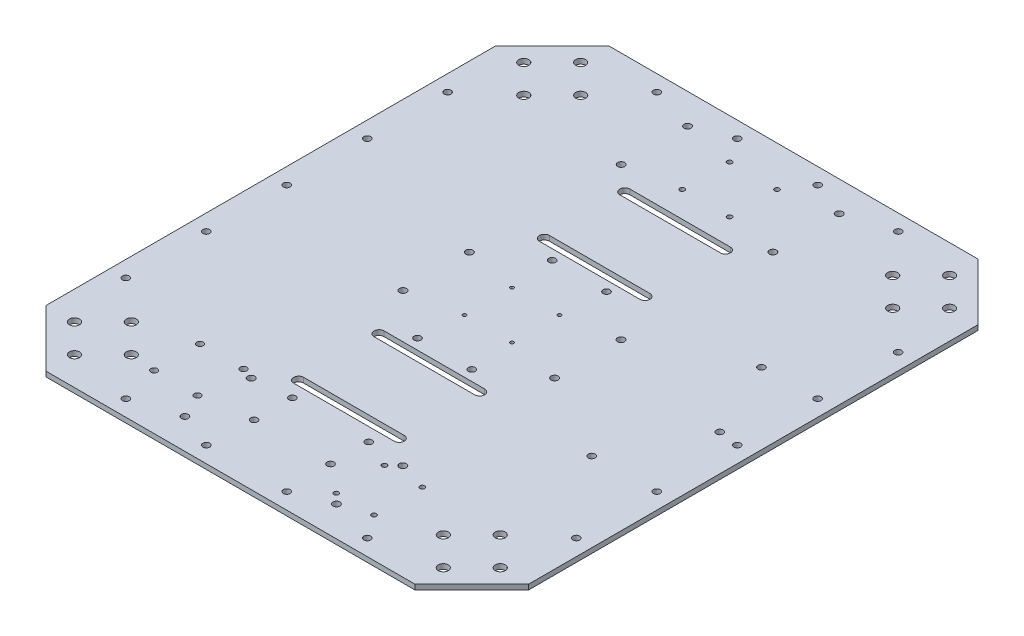
from build123d import *

# Parameters (mm, degrees)
SKETCH1_R               = 2.2225
BOSS_EXTRUDE1_DEPTH     = 3.175
SKETCH2_R               = 2.159
CUT_EXTRUDE1_DEPTH      = 297.247830215
CUT_EXTRUDE2_DEPTH      = 297.247830215
SKETCH7_R               = 1.524
CUT_EXTRUDE3_DEPTH      = 297.247830215
CUT_EXTRUDE4_DEPTH      = 297.247830215
CUT_EXTRUDE4_DEPTH_BACK = 297.247830215
SKETCH8_R               = 1.524
SKETCH9_R               = 2.032
CUT_EXTRUDE5_DEPTH      = 297.247830215
SKETCH10_R              = 2.159
CUT_EXTRUDE6_DEPTH      = 297.247830215
SKETCH13_R              = 1.1
CUT_EXTRUDE8_DEPTH      = 297.247830215
SKETCH14_R              = 3.175
CUT_EXTRUDE9_DEPTH      = 297.247830215
SKETCH15_R              = 2.159
CUT_EXTRUDE10_DEPTH     = 297.247830215
SKETCH16_R              = 2.159
CUT_EXTRUDE11_DEPTH     = 297.247830215


with BuildPart() as part:
    # Sketch1 → Boss-Extrude1 (new body)
    with BuildSketch(Plane(origin=(0, 0, 0), x_dir=(1, 0, 0), z_dir=(0, 1, 0))):
        Polygon((-85.365028143, 123.058976948), (-121.286052627, 87.137952464), (-121.286052627, -196.619998567), (-85.365028143, -232.541023052), (147.592922888, -232.541023052), (183.513947373, -196.619998567), (183.513947373, 87.137952464), (147.592922888, 123.058976948), align=None)
        with Locations((-16.765052627, -213.491023052)):
            Circle(SKETCH1_R, mode=Mode.SUBTRACT)
        with Locations((-16.765052627, -171.581023052)):
            Circle(SKETCH1_R, mode=Mode.SUBTRACT)
        with Locations((-16.765052627, -75.696023052)):
            Circle(SKETCH1_R, mode=Mode.SUBTRACT)
        with Locations((78.992947373, -213.491023052)):
            Circle(SKETCH1_R, mode=Mode.SUBTRACT)
        with Locations((78.992947373, -171.581023052)):
            Circle(SKETCH1_R, mode=Mode.SUBTRACT)
        with Locations((78.992947373, -75.696023052)):
            Circle(SKETCH1_R, mode=Mode.SUBTRACT)
        with Locations((-16.765052627, -33.786023052)):
            Circle(SKETCH1_R, mode=Mode.SUBTRACT)
        with Locations((-16.765052627, 62.098976948)):
            Circle(SKETCH1_R, mode=Mode.SUBTRACT)
        with Locations((-16.765052627, 104.008976948)):
            Circle(SKETCH1_R, mode=Mode.SUBTRACT)
        with Locations((78.992947373, -33.786023052)):
            Circle(SKETCH1_R, mode=Mode.SUBTRACT)
        with Locations((78.992947373, 62.098976948)):
            Circle(SKETCH1_R, mode=Mode.SUBTRACT)
        with Locations((78.992947373, 104.008976948)):
            Circle(SKETCH1_R, mode=Mode.SUBTRACT)
    extrude(amount=BOSS_EXTRUDE1_DEPTH)

    # Sketch2 → Cut-Extrude1 (cut, through all)
    with BuildSketch(Plane(origin=(0, 3.175, 0), x_dir=(1, 0, 0), z_dir=(0, 1, 0))):
        with Locations((13.841947373, -12.069023052)):
            Circle(SKETCH2_R)
        with Locations((48.131947373, -12.069023052)):
            Circle(SKETCH2_R)
        with Locations((13.841947373, -97.159023052)):
            Circle(SKETCH2_R)
        with Locations((48.131947373, -97.159023052)):
            Circle(SKETCH2_R)
    extrude(amount=-CUT_EXTRUDE1_DEPTH, mode=Mode.SUBTRACT)

    # Sketch4 → Cut-Extrude2 (cut, through all)
    with BuildSketch(Plane(origin=(0, 3.175, 0), x_dir=(1, 0, 0), z_dir=(0, 1, 0))):
        with BuildLine():
            Line((-0.636052627, 51.430976948), (62.863947373, 51.430976948))
            ThreePointArc((62.863947373, 51.430976948), (66.038947373, 48.255976948), (62.863947373, 45.080976948))
            Line((62.863947373, 45.080976948), (-0.636052627, 45.080976948))
            ThreePointArc((-0.636052627, 45.080976948), (-3.811052627, 48.255976948), (-0.636052627, 51.430976948))
        make_face()
        with BuildLine():
            Line((-0.636052627, 0.630976948), (62.863947373, 0.630976948))
            ThreePointArc((62.863947373, 0.630976948), (66.038947373, -2.544023052), (62.863947373, -5.719023052))
            Line((62.863947373, -5.719023052), (-0.636052627, -5.719023052))
            ThreePointArc((-0.636052627, -5.719023052), (-3.811052627, -2.544023052), (-0.636052627, 0.630976948))
        make_face()
        with BuildLine():
            Line((-0.636052627, -110.113023052), (62.863947373, -110.113023052))
            ThreePointArc((62.863947373, -110.113023052), (66.038947373, -106.938023052), (62.863947373, -103.763023052))
            Line((62.863947373, -103.763023052), (-0.636052627, -103.763023052))
            ThreePointArc((-0.636052627, -103.763023052), (-3.811052627, -106.938023052), (-0.636052627, -110.113023052))
        make_face()
        with BuildLine():
            Line((-0.636052627, -160.913023052), (62.863947373, -160.913023052))
            ThreePointArc((62.863947373, -160.913023052), (66.038947373, -157.738023052), (62.863947373, -154.563023052))
            Line((62.863947373, -154.563023052), (-0.636052627, -154.563023052))
            ThreePointArc((-0.636052627, -154.563023052), (-3.811052627, -157.738023052), (-0.636052627, -160.913023052))
        make_face()
    extrude(amount=-CUT_EXTRUDE2_DEPTH, mode=Mode.SUBTRACT)

    # Sketch7 → Cut-Extrude3 (cut, through all)
    with BuildSketch(Plane(origin=(0, 3.175, 0), x_dir=(1, 0, 0), z_dir=(0, 1, 0))):
        with Locations((16.127947373, 67.686976948)):
            Circle(SKETCH7_R)
        with Locations((46.099947373, 67.686976948)):
            Circle(SKETCH7_R)
        with Locations((16.127947373, 97.658976948)):
            Circle(SKETCH7_R)
        with Locations((46.099947373, 97.658976948)):
            Circle(SKETCH7_R)
    extrude(amount=-CUT_EXTRUDE3_DEPTH, mode=Mode.SUBTRACT)

    # Sketch8 → Cut-Extrude4 (cut, two sides: drawn at the far end of the back side and taken through both)
    with BuildSketch(Plane(origin=(0, 3.175, 0), x_dir=(1, 0, 0), z_dir=(0, 1, 0)).offset(-CUT_EXTRUDE4_DEPTH_BACK)):
        with Locations((73.023947373, -207.649023052)):
            Circle(SKETCH8_R)
        with Locations((73.023947373, -177.169023052)):
            Circle(SKETCH8_R)
        with Locations((96.899947373, -207.649023052)):
            Circle(SKETCH8_R)
        with Locations((96.899947373, -177.169023052)):
            Circle(SKETCH8_R)
    extrude(amount=CUT_EXTRUDE4_DEPTH + CUT_EXTRUDE4_DEPTH_BACK, mode=Mode.SUBTRACT)

    # Sketch9 → Cut-Extrude5 (cut, through all)
    with BuildSketch(Plane(origin=(0, 0, 0), x_dir=(-1, 0, 0), z_dir=(0, -1, 0))):
        with Locations((51.649412627, -197.969083052)):
            Circle(SKETCH9_R)
        with Locations((24.217412627, -197.969083052)):
            Circle(SKETCH9_R)
        with Locations((51.649412627, -169.013083052)):
            Circle(SKETCH9_R)
        with Locations((24.217412627, -169.013083052)):
            Circle(SKETCH9_R)
    extrude(amount=-CUT_EXTRUDE5_DEPTH, mode=Mode.SUBTRACT)

    # Sketch10 → Cut-Extrude6 (cut, through all)
    with BuildSketch(Plane.XZ):
        with Locations((6.983947373, 193.475823052)):
            Circle(SKETCH10_R)
        with Locations((55.243947373, 193.475823052)):
            Circle(SKETCH10_R)
        with Locations((6.983947373, 169.345823052)):
            Circle(SKETCH10_R)
        with Locations((55.243947373, 169.345823052)):
            Circle(SKETCH10_R)
    extrude(amount=-CUT_EXTRUDE6_DEPTH, mode=Mode.SUBTRACT)

    # Sketch13 → Cut-Extrude8 (cut, through all)
    with BuildSketch(Plane.XZ):
        with Locations((16.113947373, 69.741023052)):
            Circle(SKETCH13_R)
        with Locations((16.113947373, 39.741023052)):
            Circle(SKETCH13_R)
        with Locations((46.113947373, 39.741023052)):
            Circle(SKETCH13_R)
        with Locations((46.113947373, 69.741023052)):
            Circle(SKETCH13_R)
    extrude(amount=-CUT_EXTRUDE8_DEPTH, mode=Mode.SUBTRACT)

    # Sketch14 → Cut-Extrude9 (cut, through all)
    with BuildSketch(Plane.XZ):
        with Locations((-103.325540385, 196.619998567)):
            Circle(SKETCH14_R)
        with Locations((-85.365028143, 214.580510809)):
            Circle(SKETCH14_R)
        with Locations((-85.365028143, 178.659486325)):
            Circle(SKETCH14_R)
        with Locations((-67.404515901, 196.619998567)):
            Circle(SKETCH14_R)
        with Locations((129.632410646, 196.619998567)):
            Circle(SKETCH14_R)
        with Locations((147.592922888, 178.659486325)):
            Circle(SKETCH14_R)
        with Locations((165.55343513, 196.619998567)):
            Circle(SKETCH14_R)
        with Locations((147.592922888, 214.580510809)):
            Circle(SKETCH14_R)
        with Locations((-85.365028143, -105.098464706)):
            Circle(SKETCH14_R)
        with Locations((-103.325540385, -87.137952464)):
            Circle(SKETCH14_R)
        with Locations((-85.365028143, -69.177440222)):
            Circle(SKETCH14_R)
        with Locations((-67.404515901, -87.137952464)):
            Circle(SKETCH14_R)
        with Locations((165.55343513, -87.137952464)):
            Circle(SKETCH14_R)
        with Locations((147.592922888, -69.177440222)):
            Circle(SKETCH14_R)
        with Locations((147.592922888, -105.098464706)):
            Circle(SKETCH14_R)
        with Locations((129.632410646, -87.137952464)):
            Circle(SKETCH14_R)
    extrude(amount=-CUT_EXTRUDE9_DEPTH, mode=Mode.SUBTRACT)

    # Sketch15 → Cut-Extrude10 (cut, through all)
    with BuildSketch(Plane.XZ):
        with Locations((5.713947373, 222.381023052)):
            Circle(SKETCH15_R)
        with Locations((-45.086052627, 222.381023052)):
            Circle(SKETCH15_R)
        with Locations((-111.126052627, 54.741023052)):
            Circle(SKETCH15_R)
        with Locations((-111.126052627, 105.541023052)):
            Circle(SKETCH15_R)
        with Locations((-111.126052627, 156.341023052)):
            Circle(SKETCH15_R)
        with Locations((173.353947373, 156.341023052)):
            Circle(SKETCH15_R)
        with Locations((173.353947373, 105.541023052)):
            Circle(SKETCH15_R)
        with Locations((173.353947373, 54.741023052)):
            Circle(SKETCH15_R)
        with Locations((107.313947373, 222.381023052)):
            Circle(SKETCH15_R)
        with Locations((56.513947373, 222.381023052)):
            Circle(SKETCH15_R)
        with Locations((56.513947373, -112.898976948)):
            Circle(SKETCH15_R)
        with Locations((107.313947373, -112.898976948)):
            Circle(SKETCH15_R)
        with Locations((173.353947373, 3.941023052)):
            Circle(SKETCH15_R)
        with Locations((173.353947373, -46.858976948)):
            Circle(SKETCH15_R)
        with Locations((-111.126052627, -46.858976948)):
            Circle(SKETCH15_R)
        with Locations((-111.126052627, 3.941023052)):
            Circle(SKETCH15_R)
        with Locations((-45.086052627, -112.898976948)):
            Circle(SKETCH15_R)
        with Locations((5.713947373, -112.898976948)):
            Circle(SKETCH15_R)
    extrude(amount=-CUT_EXTRUDE10_DEPTH, mode=Mode.SUBTRACT)

    # Sketch16 → Cut-Extrude11 (cut, through all)
    with BuildSketch(Plane(origin=(0, 0, 0), x_dir=(-1, 0, 0), z_dir=(0, -1, 0))):
        with Locations((-133.333707373, -106.679409794)):
            Circle(SKETCH16_R)
        with Locations((-138.413707373, -4.529409794)):
            Circle(SKETCH16_R)
        with Locations((-160.653947373, -53.029409794)):
            Circle(SKETCH16_R)
    extrude(amount=-CUT_EXTRUDE11_DEPTH, mode=Mode.SUBTRACT)


solid = part.part
